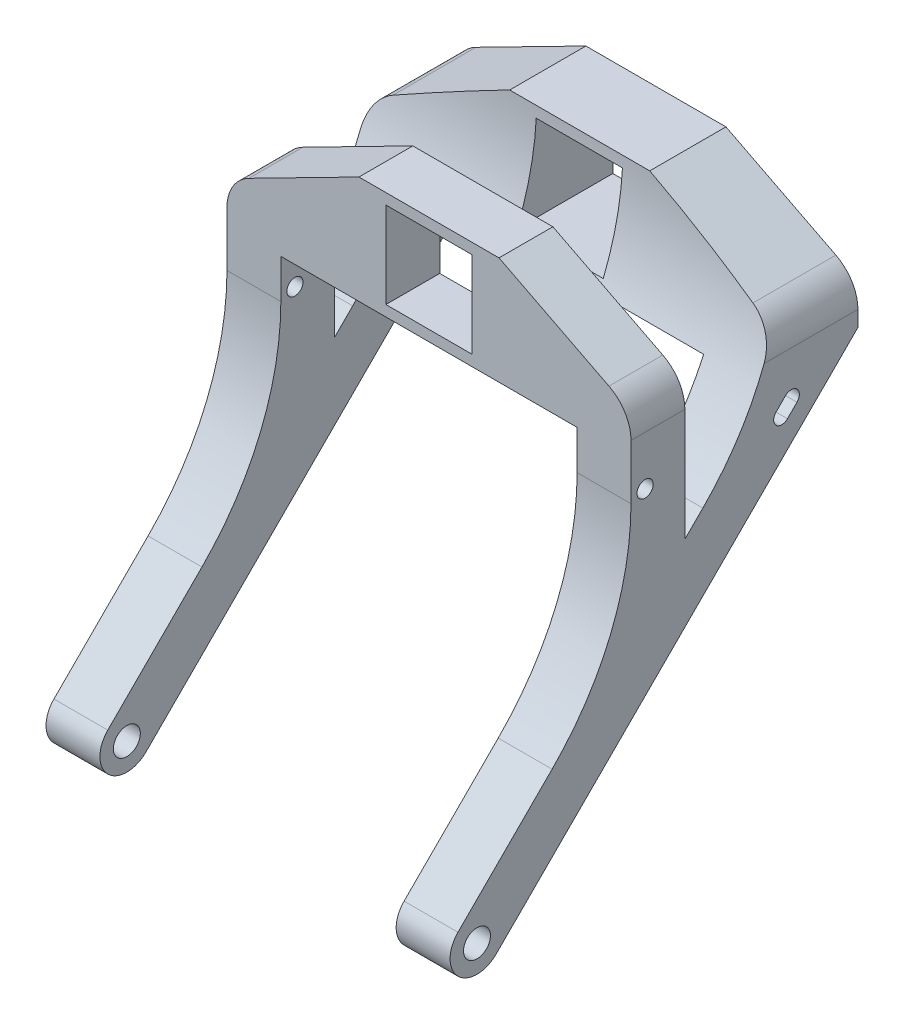
from build123d import *

# Parameters (mm, degrees)
BOSS_EXTRUDE1_DEPTH     = 75
BOSS_EXTRUDE2_DEPTH     = 75
SKETCH6_W               = 32
SKETCH6_H               = 32
CUT_EXTRUDE1_DEPTH      = 232.532584422
FILLET1_START           = -75
FILLET1_DEPTH           = 150
FILLET1_START_2         = -40.56574
FILLET1_2_DEPTH         = 24.56574
FILLET1_START_3         = 16
FILLET1_3_DEPTH         = 10
FILLET1_START_4         = -26
FILLET1_4_DEPTH         = 101
FILLET1_5_DEPTH         = 34.43426
FILLET1_START_5         = -113.13708499
FILLET1_6_OUTLINE_W     = 32
FILLET1_6_OUTLINE_H     = 32
FILLET1_6_DEPTH         = 29.279073903
CUT_EXTRUDE3_DEPTH      = 232.532584422
CUT_EXTRUDE3_DEPTH_BACK = 232.532584422
SKETCH10_W              = 110
SKETCH10_H              = 254.558441228
CUT_EXTRUDE4_DEPTH      = 232.532584422
CUT_EXTRUDE4_DEPTH_BACK = 232.532584422
SKETCH11_R              = 5
SKETCH11_R_2            = 3
FILLET2_R               = 15


with BuildPart() as part:
    # Sketch3 → Boss-Extrude1 (new, symmetric)
    with BuildSketch(Plane(origin=(0, 0, 0), x_dir=(0, 0, -1), z_dir=(1, 0, 0))):
        with BuildLine():
            Line((7.071067812, -7.071067812), (141.421356237, 127.279220614))
            Line((141.421356237, 127.279220614), (141.421356237, 167.279220614))
            Line((141.421356237, 167.279220614), (113.13708499, 167.279220614))
            Line((113.13708499, 167.279220614), (113.13708499, 127.279220614))
            Line((113.13708499, 127.279220614), (-7.071067812, 7.071067812))
            ThreePointArc((-7.071067812, 7.071067812), (-7.071067812, -7.071067812), (7.071067812, -7.071067812))
        make_face()
    extrude(amount=BOSS_EXTRUDE1_DEPTH, both=True)

    # Sketch9 → Boss-Extrude2 (add, symmetric)
    with BuildSketch(Plane(origin=(0, 0, 0), x_dir=(0, 0, -1), z_dir=(1, 0, 0))):
        Polygon((57.175144213, 127.279220614), (57.175144213, 167.279220614), (77.175144213, 167.279220614), (77.175144213, 127.279220614), (77.175144213, 91.317279836), (57.175144213, 71.317279836), align=None)
    extrude(amount=BOSS_EXTRUDE2_DEPTH, both=True)

    # Sketch6 → Cut-Extrude1 (cut, through all)
    with BuildSketch(Plane.XY):
        with Locations((0, 147.279220614)):
            Rectangle(SKETCH6_W, SKETCH6_H)
        Polygon((-26, 167.279220614), (-75, 142.279220614), (-75, 167.279220614), align=None)
        Polygon((26, 167.279220614), (75, 167.279220614), (75, 142.279220614), align=None)
    extrude(amount=-CUT_EXTRUDE1_DEPTH, mode=Mode.SUBTRACT)

    # Fillet1: read off the stored shape, not the designer's step
    # Fillet1 outline → Fillet1 (add)
    with BuildSketch(Plane.YZ.offset(FILLET1_START)):
        with BuildLine():
            Line((131.279220614, -113.13708499), (131.279220614, -105.877452163))
            ThreePointArc((131.279220614, -105.877452163), (113.530191873, -96.544561619), (98.00014671, -83.858011087))
            Line((98.00014671, -83.858011087), (127.279220614, -113.13708499))
            Line((127.279220614, -113.13708499), (131.279220614, -113.13708499))
        make_face()
        with BuildLine():
            Line((71.317279836, -57.175144213), (112.738636074, -57.175144213))
            ThreePointArc((112.738636074, -57.175144213), (74.470292837, -49.563097464), (42.027957955, -27.885822331))
            Line((42.027957955, -27.885822331), (71.317279836, -57.175144213))
        make_face()
    extrude(amount=FILLET1_DEPTH)

    # Fillet1 2 outline → Fillet1 2 (add)
    with BuildSketch(Plane.YZ.offset(FILLET1_START_2)):
        with BuildLine():
            ThreePointArc((167.279220614, -113.13708499), (148.943103424, -111.174049686), (131.279220614, -105.877452163))
            Line((131.279220614, -105.877452163), (131.279220614, -113.13708499))
            Line((131.279220614, -113.13708499), (167.279220614, -113.13708499))
        make_face()
    extrude(amount=FILLET1_2_DEPTH)

    # Fillet1 3 outline → Fillet1 3 (add)
    with BuildSketch(Plane.YZ.offset(FILLET1_START_3)):
        with BuildLine():
            ThreePointArc((167.279220614, -113.13708499), (148.943103424, -111.174049686), (131.279220614, -105.877452163))
            Line((131.279220614, -105.877452163), (131.279220614, -113.13708499))
            Line((131.279220614, -113.13708499), (167.279220614, -113.13708499))
        make_face()
    extrude(amount=FILLET1_3_DEPTH)

    # Fillet1 4 outline → Fillet1 4 (add)
    with BuildSketch(Plane.YZ.offset(FILLET1_START_4)):
        with BuildLine():
            Line((131.279220614, -113.13708499), (167.279220614, -113.13708499))
            ThreePointArc((167.279220614, -113.13708499), (148.943103424, -111.174049686), (131.279220614, -105.877452163))
            Line((131.279220614, -105.877452163), (131.279220614, -113.13708499))
        make_face()
    extrude(amount=FILLET1_4_DEPTH)

    # Fillet1 5 outline → Fillet1 5 (add)
    with BuildSketch(Plane.YZ.offset(FILLET1_START)):
        with BuildLine():
            Line((131.279220614, -113.13708499), (167.279220614, -113.13708499))
            ThreePointArc((167.279220614, -113.13708499), (148.943103424, -111.174049686), (131.279220614, -105.877452163))
            Line((131.279220614, -105.877452163), (131.279220614, -113.13708499))
        make_face()
    extrude(amount=FILLET1_5_DEPTH)

    # Fillet1 6 outline → Fillet1 6 (cut)
    with BuildSketch(Plane.XY.offset(FILLET1_START_5)):
        Polygon((75, 167.279220614), (26, 167.279220614), (75, 142.279220614), align=None)
        Polygon((-26, 167.279220614), (-75, 167.279220614), (-75, 142.279220614), align=None)
        with Locations((0, 147.279220614)):
            Rectangle(FILLET1_6_OUTLINE_W, FILLET1_6_OUTLINE_H)
    extrude(amount=FILLET1_6_DEPTH, mode=Mode.SUBTRACT)

    # Sketch10 → Cut-Extrude3 (cut, two sides: drawn at the far end of the back side and taken through both)
    with BuildSketch(Plane.XY.offset(-CUT_EXTRUDE3_DEPTH_BACK)):
        Rectangle(SKETCH10_W, SKETCH10_H)
    extrude(amount=CUT_EXTRUDE3_DEPTH + CUT_EXTRUDE3_DEPTH_BACK, mode=Mode.SUBTRACT)

    # Sketch11 → Cut-Extrude4 (cut, two sides: drawn at the far end of the back side and taken through both)
    with BuildSketch(Plane(origin=(0, 0, 0), x_dir=(0, 0, -1), z_dir=(1, 0, 0)).offset(-CUT_EXTRUDE4_DEPTH_BACK)):
        Circle(SKETCH11_R)
        with Locations((62.404851943, 114.904851943)):
            Circle(SKETCH11_R_2)
        with BuildLine():
            Line((118.793939239, 114.551298552), (115.258405333, 111.015764646))
            ThreePointArc((115.258405333, 111.015764646), (111.015764646, 111.015764646), (111.015764646, 115.258405333))
            Line((111.015764646, 115.258405333), (114.551298552, 118.793939239))
            ThreePointArc((114.551298552, 118.793939239), (118.793939239, 118.793939239), (118.793939239, 114.551298552))
        make_face()
    extrude(amount=CUT_EXTRUDE4_DEPTH + CUT_EXTRUDE4_DEPTH_BACK, mode=Mode.SUBTRACT)

    # Fillet2
    fillet2_edges = [part.edges().sort_by_distance(p)[0] for p in [
        (75, 142.279220614, -127.279220614),
        (75, 142.279220614, -67.175144213),
        (-75, 142.279220614, -127.279220614),
        (-75, 142.279220614, -67.175144213),
    ]]
    fillet(fillet2_edges, radius=FILLET2_R)


solid = part.part
